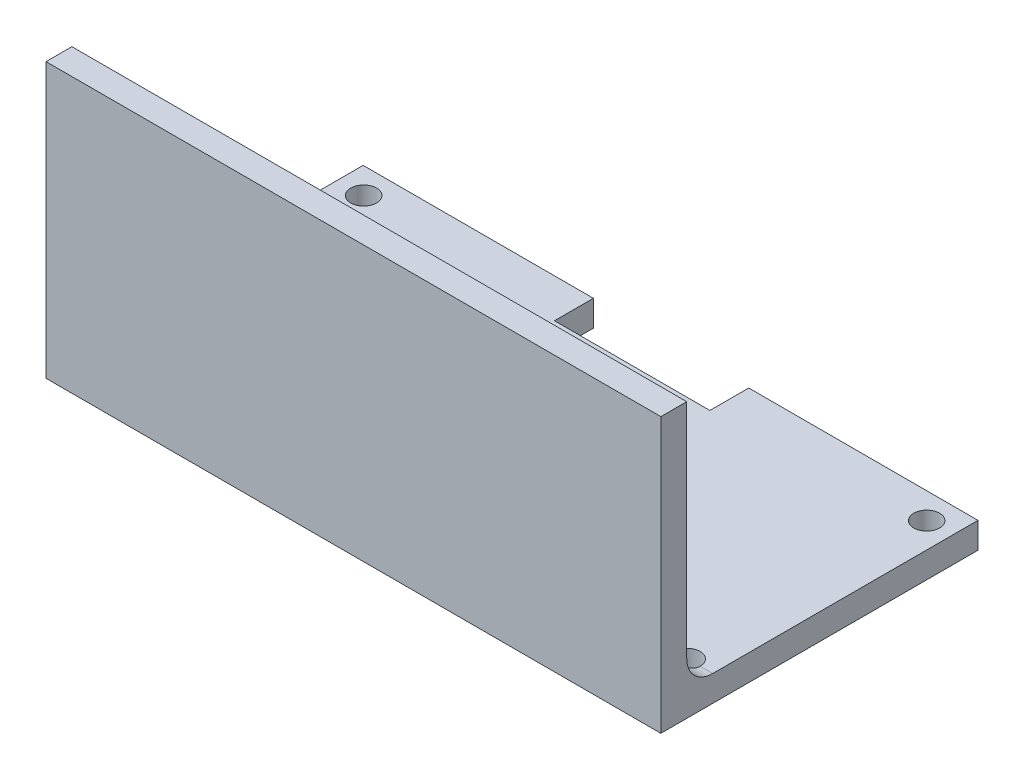
from build123d import *

# Parameters (mm, degrees)
SKETCH3_W           = 47.5
SKETCH3_H           = 22.5
BOSS_EXTRUDE1_DEPTH = 2
SKETCH56_R          = 0.99762119
CUT_EXTRUDE1_DEPTH  = 10
SKETCH53_R          = 0.995230863
CUT_EXTRUDE2_DEPTH  = 10
SKETCH52_R          = 1
CUT_EXTRUDE3_DEPTH  = 10
SKETCH57_R          = 1
CUT_EXTRUDE4_DEPTH  = 10
SKETCH74_W          = 12.004185621
SKETCH74_H          = 3.004883548
CUT_EXTRUDE6_DEPTH  = 10
SKETCH79_W          = 47.5
SKETCH79_H          = 2
BOSS_EXTRUDE2_DEPTH = 21.190075336
FILLET6_R           = 2


with BuildPart() as part:
    # Sketch3 → Boss-Extrude1 (new body)
    with BuildSketch(Plane(origin=(0, 0, 0), x_dir=(1, 0, 0), z_dir=(0, 1, 0))):
        with Locations((-56.111912524, -4.514800621)):
            Rectangle(SKETCH3_W, SKETCH3_H)
    extrude(amount=BOSS_EXTRUDE1_DEPTH)

    # Sketch56 → Cut-Extrude1 (cut)
    with BuildSketch(Plane(origin=(0, 0, 0), x_dir=(-1, 0, 0), z_dir=(0, -1, 0))):
        with Locations(Location((34.326389274, -13.765097561, 0), (0, 0, 90))):
            Circle(SKETCH56_R)
    extrude(amount=-CUT_EXTRUDE1_DEPTH, mode=Mode.SUBTRACT)

    # Sketch53 → Cut-Extrude2 (cut)
    with BuildSketch(Plane(origin=(0.004388193, 0, 0), x_dir=(-1, 0, 0), z_dir=(0, -1, 0))):
        with Locations(Location((34.328904029, 4.735389548, 0), (0, 0, 90))):
            Circle(SKETCH53_R)
    extrude(amount=-CUT_EXTRUDE2_DEPTH, mode=Mode.SUBTRACT)

    # Sketch52 → Cut-Extrude3 (cut)
    with BuildSketch(Plane(origin=(0, 0, -0.040736422), x_dir=(1, 0, 0), z_dir=(0, -1, 0))):
        with Locations(Location((-77.82393232, -4.694462956, 0), (0, 0, 270))):
            Circle(SKETCH52_R)
    extrude(amount=-CUT_EXTRUDE3_DEPTH, mode=Mode.SUBTRACT)

    # Sketch57 → Cut-Extrude4 (cut)
    with BuildSketch(Plane.XZ):
        with Locations(Location((-77.826389274, 13.764800621, 0), (0, 0, 270))):
            Circle(SKETCH57_R)
    extrude(amount=-CUT_EXTRUDE4_DEPTH, mode=Mode.SUBTRACT)

    # Sketch74 → Cut-Extrude6 (cut)
    with BuildSketch(Plane(origin=(0, 2, 0), x_dir=(1, 0, 0), z_dir=(0, 1, 0))):
        with Locations((-56.07183951, 5.232757605)):
            Rectangle(SKETCH74_W, SKETCH74_H)
    extrude(amount=-CUT_EXTRUDE6_DEPTH, mode=Mode.SUBTRACT)

    # Sketch79 → Boss-Extrude2 (add)
    with BuildSketch(Plane(origin=(0, 0, 0), x_dir=(1, 0, 0), z_dir=(0, 1, 0))):
        with Locations((-56.111912524, -16.764800621)):
            Rectangle(SKETCH79_W, SKETCH79_H)
    extrude(amount=BOSS_EXTRUDE2_DEPTH)

    # Fillet6
    # the kernel refuses this fillet: 2 mm, written as the material it adds along each edge
    with BuildSketch(Plane(origin=(-32.361912524, 2, 15.764800621), x_dir=(0, 1, 0), z_dir=(-1, 0, 0))) as fillet6_piece_1_section:
        with BuildLine():
            CenterArc((FILLET6_R, FILLET6_R), FILLET6_R, 180, 90)
            Line((0, FILLET6_R), (0, 0))
            Line((0, 0), (FILLET6_R, 0))
        make_face()
    fillet6_piece_1 = extrude(amount=47.5, mode=Mode.PRIVATE)
    fillet6_piece_1 = fillet6_piece_1 - Plane(origin=(-34.326389274, 2.455648449, 13.765097561), x_dir=(0, 0, -1), z_dir=(0, -1, 0)) * Cylinder(0.99762119, 103, mode=Mode.PRIVATE)
    fillet6_piece_1 = fillet6_piece_1 - Plane(origin=(-77.826389274, 2.455648449, 13.764800621), x_dir=(0, 0, -1), z_dir=(0, -1, 0)) * Cylinder(1, 103, mode=Mode.PRIVATE)
    add(fillet6_piece_1)


solid = part.part
